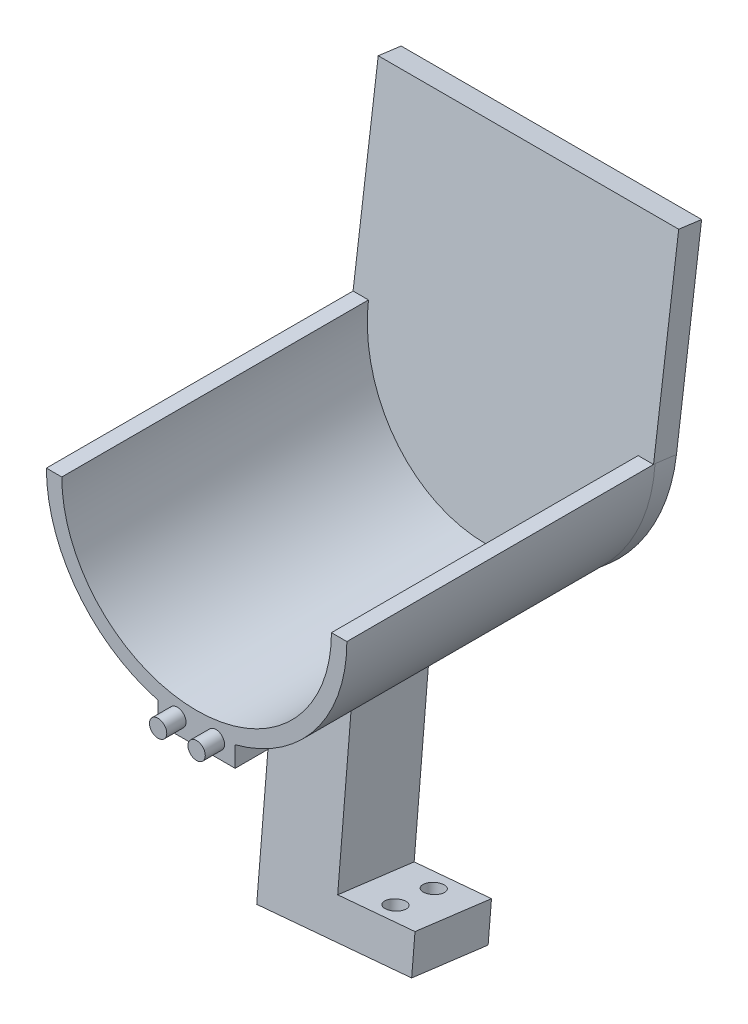
from build123d import *

# Parameters (mm, degrees)
EXTRUDE_THIN1_DEPTH       = 80
BOSS_EXTRUDE1_START       = -10
BOSS_EXTRUDE1_DEPTH       = 10
SKETCH3_R                 = 2.25
BOSS_EXTRUDE2_DEPTH       = 5
BOSS_EXTRUDE3_DEPTH       = 10
SKETCH5_R                 = 2.25
CUT_EXTRUDE1_DEPTH        = 6
BOSS_EXTRUDE4_REACH       = 104.415
BOSS_EXTRUDE4_END_RADIUS  = 39
SKETCH10_W                = 20
SKETCH10_H                = 20
BOSS_EXTRUDE6_DEPTH       = 6
BOSS_EXTRUDE7_START       = -51.724499634
BOSS_EXTRUDE7_OUTLINE_W   = 20
BOSS_EXTRUDE7_OUTLINE_H   = 20
BOSS_EXTRUDE7_DEPTH       = 51.724499634
BOSS_EXTRUDE7_START_2     = 101.306507824
BOSS_EXTRUDE7_2_OUTLINE_W = 23
BOSS_EXTRUDE7_2_OUTLINE_H = 23
BOSS_EXTRUDE7_2_DEPTH     = 3.693492176
BOSS_EXTRUDE9_DEPTH       = 20
SKETCH16_R                = 2.5
CUT_EXTRUDE2_DEPTH        = 20


with BuildPart() as part:
    # Sketch1 → Extrude-Thin1 (new body)
    with BuildSketch(Plane.XY):
        with BuildLine():
            ThreePointArc((-35, 0), (0, -35), (35, 0))
            Line((35, 0), (39, 0))
            ThreePointArc((39, 0), (0, -39), (-39, 0))
            Line((-39, 0), (-35, 0))
        make_face()
    extrude(amount=EXTRUDE_THIN1_DEPTH)

    # Sketch2 → Boss-Extrude1 (add)
    with BuildSketch(Plane.XY.offset(80).offset(BOSS_EXTRUDE1_START)):
        with BuildLine():
            Line((0, -39), (0, -35))
            Line((0, -35), (-10, -35))
            Line((-10, -35), (-10, -37.69615365))
            ThreePointArc((-10, -37.69615365), (-5.042321274, -38.672664715), (0, -39))
        make_face()
        with BuildLine():
            Line((10, -35), (0, -35))
            Line((0, -35), (0, -39))
            ThreePointArc((0, -39), (5.042321274, -38.672664715), (10, -37.69615365))
            Line((10, -37.69615365), (10, -35))
        make_face()
        with BuildLine():
            ThreePointArc((10, -37.69615365), (5.042321274, -38.672664715), (0, -39))
            ThreePointArc((0, -39), (-5.042321274, -38.672664715), (-10, -37.69615365))
            Line((-10, -37.69615365), (-10, -43))
            Line((-10, -43), (10, -43))
            Line((10, -43), (10, -37.69615365))
        make_face()
    extrude(amount=BOSS_EXTRUDE1_DEPTH)

    # Sketch3 → Boss-Extrude2 (add)
    with BuildSketch(Plane.XY.offset(80)):
        with Locations((-5, -39)):
            Circle(SKETCH3_R)
        with Locations((5, -39)):
            Circle(SKETCH3_R)
    extrude(amount=BOSS_EXTRUDE2_DEPTH)

    # Sketch4 → Boss-Extrude3 (add)
    with BuildSketch(Plane(origin=(0, 0, 0), x_dir=(-1, 0, 0), z_dir=(0, 0, -1))):
        with BuildLine():
            Line((0, -39), (0, -35))
            Line((0, -35), (-10, -35))
            Line((-10, -35), (-10, -37.69615365))
            ThreePointArc((-10, -37.69615365), (-5.042321274, -38.672664715), (0, -39))
        make_face()
        with BuildLine():
            ThreePointArc((10, -37.69615365), (5.042321274, -38.672664715), (0, -39))
            ThreePointArc((0, -39), (-5.042321274, -38.672664715), (-10, -37.69615365))
            Line((-10, -37.69615365), (-10, -43))
            Line((-10, -43), (10, -43))
            Line((10, -43), (10, -37.69615365))
        make_face()
        with BuildLine():
            Line((10, -35), (0, -35))
            Line((0, -35), (0, -39))
            ThreePointArc((0, -39), (5.042321274, -38.672664715), (10, -37.69615365))
            Line((10, -37.69615365), (10, -35))
        make_face()
    extrude(amount=-BOSS_EXTRUDE3_DEPTH)

    # Sketch5 → Cut-Extrude1 (cut)
    with BuildSketch(Plane(origin=(0, 0, 0), x_dir=(-1, 0, 0), z_dir=(0, 0, -1))):
        with Locations(Location((-5, -39, 0), (0, 0, 180))):
            Circle(SKETCH5_R)
        with Locations(Location((5, -39, 0), (0, 0, 180))):
            Circle(SKETCH5_R)
    extrude(amount=-CUT_EXTRUDE1_DEPTH, mode=Mode.SUBTRACT)

    # Boss-Extrude4: up to this cylinder (the profile starts outside it)
    boss_extrude4_end = Plane(origin=(0, 0, 40), z_dir=(0, 0, -1)) * Cylinder(BOSS_EXTRUDE4_END_RADIUS, 287.83, mode=Mode.PRIVATE)
    # Sketch10 → Boss-Extrude4 (add, up to the surface)
    with BuildSketch(Plane(origin=(0, -49.619293796, 4.341125699), x_dir=(1, 0, 0), z_dir=(0, 0.9961946980917462, -0.08715574274765152)), mode=Mode.PRIVATE) as boss_extrude4_sk1:
        with Locations((0, -35.795085407)):
            Rectangle(SKETCH10_W, SKETCH10_H)
    boss_extrude4_tool1 = extrude(boss_extrude4_sk1.sketch, amount=BOSS_EXTRUDE4_REACH, mode=Mode.PRIVATE) - boss_extrude4_end
    add(boss_extrude4_tool1.solids().sort_by_distance((0, -46.499547, 40))[0])

    # Sketch14 → Boss-Extrude6 (add)
    with BuildSketch(Plane(origin=(0, -0.732594735, -5.56460947), x_dir=(1, 0, 0), z_dir=(0, 0.130526192220045, 0.9914448613738114))):
        with BuildLine():
            Line((-39, 0), (-39, 50))
            Line((-39, 50), (39, 50))
            Line((39, 50), (39, 0))
            ThreePointArc((39, 0), (0, -39), (-39, 0))
        make_face()
    extrude(amount=BOSS_EXTRUDE6_DEPTH)

    # Boss-Extrude7: read off the stored shape, not the designer's step
    # Boss-Extrude7 outline → Boss-Extrude7 (add)
    with BuildSketch(Plane(origin=(0, -49.619293796, 4.341125699), x_dir=(1, 0, 0), z_dir=(0, 0.9961946980917462, -0.08715574274765152)).offset(BOSS_EXTRUDE7_START)):
        with Locations((0, -35.795085407)):
            Rectangle(BOSS_EXTRUDE7_OUTLINE_W, BOSS_EXTRUDE7_OUTLINE_H)
    extrude(amount=BOSS_EXTRUDE7_DEPTH)

    # Boss-Extrude7 2 outline → Boss-Extrude7 2 (cut)
    with BuildSketch(Plane(origin=(0, 0, 0), x_dir=(0.9966522374056315, 0.08110432407614718, -0.010315342480997143), z_dir=(0.08175767654690885, -0.9886876617314986, 0.1257473254807149)).offset(BOSS_EXTRUDE7_START_2)):
        with Locations((-8.5, 31.5)):
            Rectangle(BOSS_EXTRUDE7_2_OUTLINE_W, BOSS_EXTRUDE7_2_OUTLINE_H)
    extrude(amount=BOSS_EXTRUDE7_2_DEPTH, mode=Mode.SUBTRACT)

    # Sketch15 → Boss-Extrude9 (add, along a direction that is not the sketch's normal)
    with BuildSketch(Plane(origin=(10, 0, 0), x_dir=(0, 0, -1), z_dir=(1, 0, 0))):
        Polygon((-54.258496601, -94.737775996), (-34.403038319, -97.263114251), (-33.528151684, -87.263114251), (-53.383609966, -84.737775996), align=None)
    extrude(amount=BOSS_EXTRUDE9_DEPTH, dir=(0.9966471031139099, 0.08150889038643343, -0.007131103885357661))

    # Sketch16 → Cut-Extrude2 (cut)
    with BuildSketch(Plane(origin=(7.465262096, -90.276691283, 11.481940072), x_dir=(0.9966522374056315, 0.08110432407614722, -0.010315342480997126), z_dir=(-0.0817576765469089, 0.9886876617314987, -0.12574732548071466))):
        with Locations(Location((12.543149078, -37.29773566, 0), (0, 0, 270))):
            Circle(SKETCH16_R)
        with Locations(Location((12.543149078, -27.282379188, 0), (0, 0, 270))):
            Circle(SKETCH16_R)
    extrude(amount=-CUT_EXTRUDE2_DEPTH, mode=Mode.SUBTRACT)


solid = part.part
